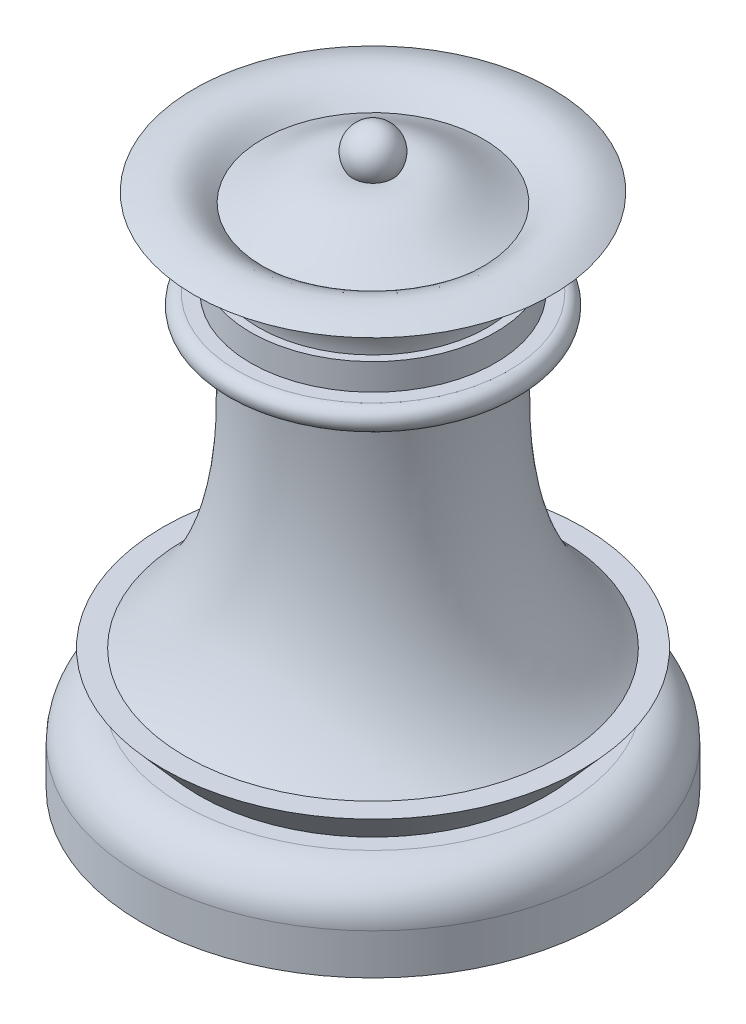
from build123d import *

# Parameters (mm, degrees)
FILLET_1_R = 1.373006
FILLET_7_R = 5


with BuildPart() as part:
    # Эскиз1 → Повернуть11 (revolve)
    with BuildSketch(Plane.XY, mode=Mode.PRIVATE) as revolve_11_sk:
        with BuildLine():
            Line((-28.319201636, 10), (-21.319202, 10))
            Line((-21.319202, 10), (-25.70187, 15))
            Line((-25.70187, 15), (-23, 15))
            add(Edge.make_bspline(
                [(-14, 50), (-11.549443609, 24.743870175), (-23, 15)],
                knots=[0, 0, 0, 0.889445697, 0.889445697, 0.889445697], degree=2))
            Line((-14, 50), (-18, 50))
            Line((-18, 50), (-18, 52.746011712))
            Line((-18, 52.746011712), (-15, 52.746011712))
            Line((-15, 52.746011712), (-15, 55.996011712))
            Line((-15, 55.996011712), (-14, 55.996011712))
            add(Edge.make_bspline(
                [(-14, 55.996011712), (-14.161861727, 59.65371566), (-17.070590258, 63.93206534), (-21.905488907, 63.404692418)],
                knots=[0, 0, 0, 0, 1, 1, 1, 1], degree=3))
            add(Edge.make_bspline(
                [(-21.905488907, 63.404692418), (-17.493420158, 65.534477533), (-15.673935308, 64.221639363), (-13.511618863, 62.267458412)],
                knots=[0, 0, 0, 0, 1, 1, 1, 1], degree=3))
            add(Edge.make_bspline(
                [(-13.511618863, 62.267458412), (-8.664813479, 64.29884008), (-7.212551469, 66.920528446), (-2.456427554, 66.051109587)],
                knots=[0, 0, 0, 0, 0.620902489, 0.620902489, 0.620902489, 0.620902489], degree=3))
            ThreePointArc((-2.456427554, 66.051109587), (-2.598911214, 69.07652309), (0, 70.631865164))
            Line((0, 70.631865164), (0, 0))
            Line((0, 0), (-28.319201636, 0))
            Line((-28.319201636, 0), (-28.319201636, 10))
        make_face()
    revolve(revolve_11_sk.sketch.rotate(Axis((0, 70.631865164, 0), (0, -1, 0)), 270), axis=Axis((0, 70.631865164, 0), (0, -1, 0)))

    # Скругление1
    fillet_1_edges = [part.edges().sort_by_distance(p)[0] for p in [
        (0, 50, -18),
        (0, 52.746011712, -18),
    ]]
    fillet(fillet_1_edges, radius=FILLET_1_R - 0.0001)  # a hair under: the kernel refuses the full size

    # Скругление7
    fillet_7_edges = [part.edges().sort_by_distance(p)[0] for p in [
        (0, 10, -28.319201636),
    ]]
    fillet(fillet_7_edges, radius=FILLET_7_R)


solid = part.part
